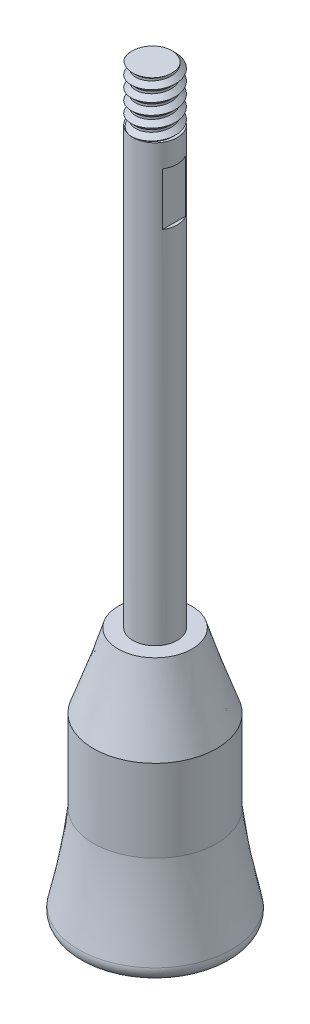
from build123d import *

# Parameters (mm, degrees)
SKETCH1_R               = 3.429
BOSS_EXTRUDE1_DEPTH     = 67.31
CUT_EXTRUDE1_DEPTH      = 68.484458818
CUT_EXTRUDE1_DEPTH_BACK = 68.484458818
SKETCH2_W               = 11.113367687
SKETCH2_H               = 8.128
SKETCH2_W_2             = 5.021300195
SKETCH6_R               = 9.525
BOSS_EXTRUDE2_DEPTH     = 12.7
FILLET2_R               = 1.778
SKETCH8_R               = 2.7432
BOSS_EXTRUDE3_DEPTH     = 8.382
SWEEP1_PITCH            = 1.71831
SKETCH12_R              = 6.927018378
CUT_EXTRUDE2_DEPTH      = 117.27684992


with BuildPart() as part:
    # Sketch1 → Boss-Extrude1 (new body)
    with BuildSketch(Plane(origin=(0, 0, 0), x_dir=(1, 0, 0), z_dir=(0, 1, 0))):
        with Locations(Location((0, 0, 0), (0, 0, 270))):
            Circle(SKETCH1_R)
    extrude(amount=BOSS_EXTRUDE1_DEPTH)

    # Sketch2 → Cut-Extrude1 (cut, two sides: drawn at the far end of the back side and taken through both)
    with BuildSketch(Plane.XY.offset(-CUT_EXTRUDE1_DEPTH_BACK)):
        with Locations((-8.477683844, 59.69)):
            Rectangle(SKETCH2_W, SKETCH2_H)
        with Locations((5.431650098, 59.69)):
            Rectangle(SKETCH2_W_2, SKETCH2_H)
    extrude(amount=CUT_EXTRUDE1_DEPTH + CUT_EXTRUDE1_DEPTH_BACK, mode=Mode.SUBTRACT)

    # Loft1: read off the stored shape, not the designer's step
    # Loft1: loft between two sections, ruled curve by curve
    loft1_from = [
        Edge.make_bspline([(0.876285429, 0, -5.647419663), (12.171124754, 0, -3.894848805), (10.418553896, 0, 7.399990521), (-0.876285429, 0, 5.647419663), (-12.171124754, 0, 3.894848805), (-10.418553896, 0, -7.399990521), (0.876285429, 0, -5.647419663)], [0, 0, 0, 0, 0.5, 0.5, 0.5, 1, 1, 1, 1], 3, [1, 0.333333333, 0.333333333, 1, 0.333333333, 0.333333333, 1]),
    ]
    loft1_to = [
        Edge.make_bspline([(4.254794346, -11.43, -8.521874798), (21.298543942, -11.43, -0.012286106), (12.78895525, -11.43, 17.03146349), (-4.254794346, -11.43, 8.521874798), (-21.298543942, -11.43, 0.012286106), (-12.78895525, -11.43, -17.03146349), (4.254794346, -11.43, -8.521874798)], [0, 0, 0, 0, 0.5, 0.5, 0.5, 1, 1, 1, 1], 3, [1, 0.333333333, 0.333333333, 1, 0.333333333, 0.333333333, 1]),
    ]
    loft1 = Solid(Shell([*[Face.make_surface_from_curves(loft1_from[k], loft1_to[k]) for k in range(1)], Face(Wire(loft1_from)), Face(Wire(loft1_to))]))
    add(loft1)

    # Sketch6 → Boss-Extrude2 (add)
    with BuildSketch(Plane.XZ.offset(11.43)):
        with Locations(Location((0, 0, 0), (0, 0, 296.532))):
            Circle(SKETCH6_R)
    extrude(amount=BOSS_EXTRUDE2_DEPTH)

    # Loft2: read off the stored shape, not the designer's step
    # Loft2: loft between two sections, ruled curve by curve
    loft2_from = [
        Edge.make_bspline([(1.359856924, -24.13, -9.427428819), (20.214714563, -24.13, -6.707714971), (17.495000715, -24.13, 12.147142668), (-1.359856924, -24.13, 9.427428819), (-20.214714563, -24.13, 6.707714971), (-17.495000715, -24.13, -12.147142668), (1.359856924, -24.13, -9.427428819)], [0, 0, 0, 0, 0.5, 0.5, 0.5, 1, 1, 1, 1], 3, [1, 0.333333333, 0.333333333, 1, 0.333333333, 0.333333333, 1]),
    ]
    loft2_to = [
        Edge.make_bspline([(-3.503732398, -39.37, -11.81023371), (20.116735022, -39.37, -18.817698506), (27.124199818, -39.37, 4.802768914), (3.503732398, -39.37, 11.81023371), (-20.116735022, -39.37, 18.817698506), (-27.124199818, -39.37, -4.802768914), (-3.503732398, -39.37, -11.81023371)], [0, 0, 0, 0, 0.5, 0.5, 0.5, 1, 1, 1, 1], 3, [1, 0.333333333, 0.333333333, 1, 0.333333333, 0.333333333, 1]),
    ]
    loft2 = Solid(Shell([*[Face.make_surface_from_curves(loft2_from[k], loft2_to[k]) for k in range(1)], Face(Wire(loft2_from)), Face(Wire(loft2_to))]))
    add(loft2)

    # Fillet2
    fillet2_edges = [part.edges().sort_by_distance(p)[0] for p in [
        (3.503732398, -39.37, 11.81023371),
    ]]
    fillet(fillet2_edges, radius=FILLET2_R)

    # Sketch8 → Boss-Extrude3 (add)
    with BuildSketch(Plane(origin=(0, 67.31, 0), x_dir=(1, 0, 0), z_dir=(0, 1, 0))):
        with Locations(Location((0, 0, 0), (0, 0, 270))):
            Circle(SKETCH8_R)
    extrude(amount=BOSS_EXTRUDE3_DEPTH)

    # Sweep1: arcs per turn and ends read off the stored shape
    # Sweep1: the profile of Sketch11 profile screwed along a right-hand helix through 5.676275 turns, 10 arcs to a turn; built about Z, then put on its axis
    sweep1_z = Axis((0, 0, 0), (0, 0, 1))
    sweep1_corners = [(2.7429, 0, 0.6861), (2.7429, 0, -0.6861), (3.429, 0, 0)]
    with BuildLine(mode=Mode.PRIVATE) as sweep1_profile:
        Line(sweep1_corners[0], sweep1_corners[1])
        Line(sweep1_corners[1], sweep1_corners[2])
        Line(sweep1_corners[2], sweep1_corners[0])
    sweep1_cap = Face(sweep1_profile.wire())
    sweep1_turn_angles = [0, 18, 36, 54, 72, 90, 108, 126, 144, 162, 180, 198, 216, 234, 252, 270, 288, 306, 324, 342, 360]
    sweep1_turn_weights = [1, 0.9510565162951535, 1, 0.9510565162951535, 1, 0.9510565162951535, 1, 0.9510565162951535, 1, 0.9510565162951535, 1, 0.9510565162951535, 1, 0.9510565162951535, 1, 0.9510565162951535, 1, 0.9510565162951535, 1, 0.9510565162951535, 1]
    sweep1_turn_rails = [Edge.make_bspline([Vector(p[0], p[1], 0).rotate(sweep1_z, sweep1_turn_angles[k]) / sweep1_turn_weights[k] + Vector(0, 0, p[2] + SWEEP1_PITCH * sweep1_turn_angles[k] / 360) for k in range(21)], [0, 0, 0, 1, 1, 2, 2, 3, 3, 4, 4, 5, 5, 6, 6, 7, 7, 8, 8, 9, 9, 10, 10, 10], 2, sweep1_turn_weights) for p in sweep1_corners]
    sweep1_turn_sides = [Face.make_surface_from_curves(sweep1_turn_rails[p[0]], sweep1_turn_rails[p[1]]) for p in [(0, 1), (1, 2), (2, 0)]]
    sweep1_last_angles = [1800, 1818, 1836, 1854, 1872, 1890, 1908, 1926, 1944, 1962, 1980, 1998, 2016, 2029.729490022, 2043.458980044]
    sweep1_last_weights = [1, 0.9510565162951535, 1, 0.9510565162951535, 1, 0.9510565162951535, 1, 0.9510565162951535, 1, 0.9510565162951535, 1, 0.9510565162951535, 1, 0.971427091198358, 1]
    sweep1_last_rails = [Edge.make_bspline([Vector(p[0], p[1], 0).rotate(sweep1_z, sweep1_last_angles[k]) / sweep1_last_weights[k] + Vector(0, 0, p[2] + SWEEP1_PITCH * sweep1_last_angles[k] / 360) for k in range(15)], [0, 0, 0, 1, 1, 2, 2, 3, 3, 4, 4, 5, 5, 6, 6, 7, 7, 7], 2, sweep1_last_weights) for p in sweep1_corners]
    sweep1_last_sides = [Face.make_surface_from_curves(sweep1_last_rails[p[0]], sweep1_last_rails[p[1]]) for p in [(0, 1), (1, 2), (2, 0)]]
    sweep1 = Plane(origin=(0, 76.3778, 0), x_dir=(1, 0, 0), z_dir=(0, -1, 0)) * Solid(Shell([*[p.moved(Location((0, 0, SWEEP1_PITCH * i))) for i in range(5) for p in sweep1_turn_sides], *sweep1_last_sides, sweep1_cap, sweep1_cap.rotate(sweep1_z, 2043.458980044).moved(Location((0, 0, SWEEP1_PITCH * 2043.458980044 / 360)))]))
    add(sweep1)

    # Sketch12 → Cut-Extrude2 (cut, through all)
    with BuildSketch(Plane(origin=(0, 75.692, 0), x_dir=(1, 0, 0), z_dir=(0, 1, 0))):
        Circle(SKETCH12_R)
    extrude(amount=CUT_EXTRUDE2_DEPTH, mode=Mode.SUBTRACT)


solid = part.part
